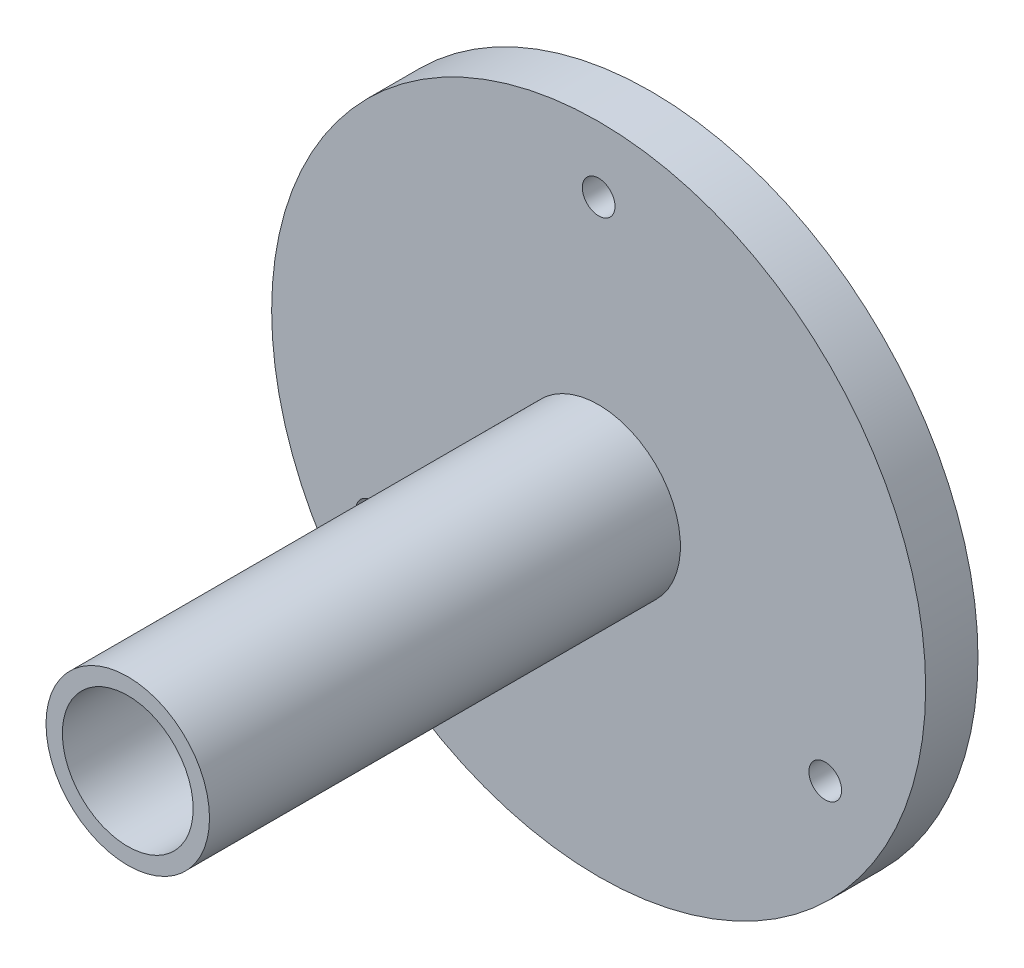
from build123d import *

# Parameters (mm, degrees)
SKETCH1_R           = 12.5
SKETCH1_R_2         = 10
BOSS_EXTRUDE1_DEPTH = 80
SKETCH2_R           = 50
SKETCH2_R_2         = 12.5
BOSS_EXTRUDE2_DEPTH = 8
SKETCH3_R           = 2.5
CUT_EXTRUDE1_DEPTH  = 8
CIRPATTERN1_COUNT   = 3


with BuildPart() as part:
    # Sketch1 → Boss-Extrude1 (new body)
    with BuildSketch(Plane.XY.offset(10)):
        Circle(SKETCH1_R)
        Circle(SKETCH1_R_2, mode=Mode.SUBTRACT)
    extrude(amount=BOSS_EXTRUDE1_DEPTH)

    # Sketch2 → Boss-Extrude2 (add)
    with BuildSketch(Plane(origin=(0, 0, 10), x_dir=(-1, 0, 0), z_dir=(0, 0, -1))):
        Circle(SKETCH2_R)
        Circle(SKETCH2_R_2, mode=Mode.SUBTRACT)
    extrude(amount=-BOSS_EXTRUDE2_DEPTH)

    # Sketch3 → Cut-Extrude1 (cut)
    with BuildSketch(Plane.XY.offset(18)):
        with Locations((0, 40)):
            Circle(SKETCH3_R)
    cut_extrude1 = extrude(amount=-CUT_EXTRUDE1_DEPTH, mode=Mode.SUBTRACT)

    # CirPattern1: Cut-Extrude1 ×3 about axis
    cirpattern1_axis = Axis((0, 0, 18), (0, 0, -1))
    for i in range(1, CIRPATTERN1_COUNT):
        add(cut_extrude1.rotate(cirpattern1_axis, i * 360 / CIRPATTERN1_COUNT), mode=Mode.SUBTRACT)


solid = part.part
